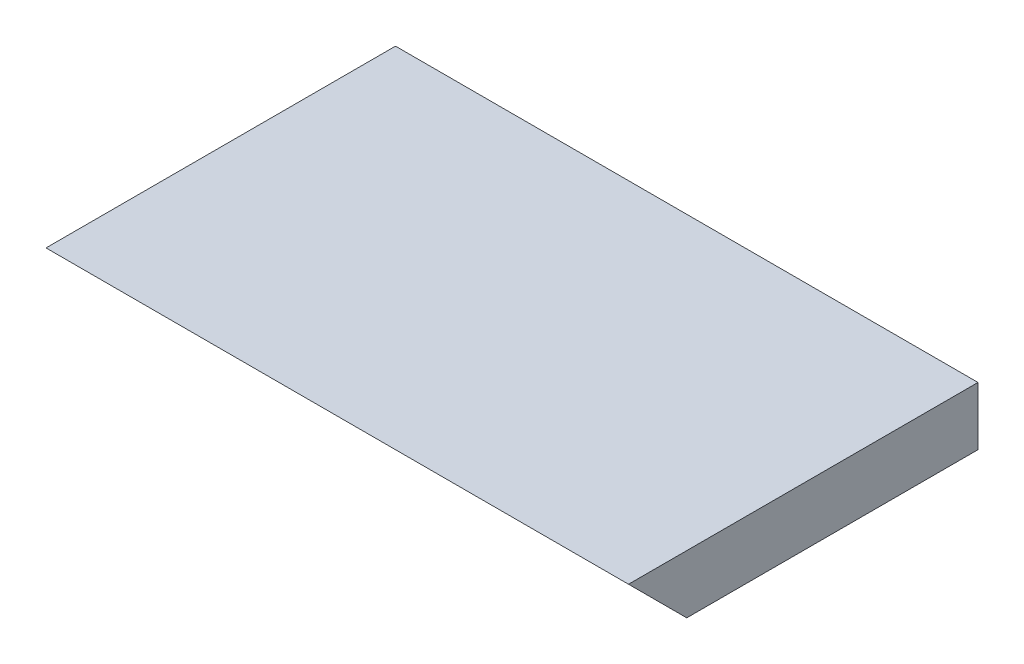
from build123d import *

# Parameters (mm, degrees)
SKETCH1_W           = 50
SKETCH1_H           = 30
BOSS_EXTRUDE1_DEPTH = 5
CHAMFER1_SIZE       = 5


with BuildPart() as part:
    # Sketch1 → Boss-Extrude1 (new body)
    with BuildSketch(Plane(origin=(0, 0, 0), x_dir=(1, 0, 0), z_dir=(0, 1, 0))):
        Rectangle(SKETCH1_W, SKETCH1_H)
    extrude(amount=BOSS_EXTRUDE1_DEPTH)

    # Chamfer1
    chamfer1_edges = [part.edges().sort_by_distance(p)[0] for p in [
        (0, 0, 15),
    ]]
    chamfer(chamfer1_edges, length=CHAMFER1_SIZE - 0.0001)  # a hair under: the kernel refuses the full size


solid = part.part
